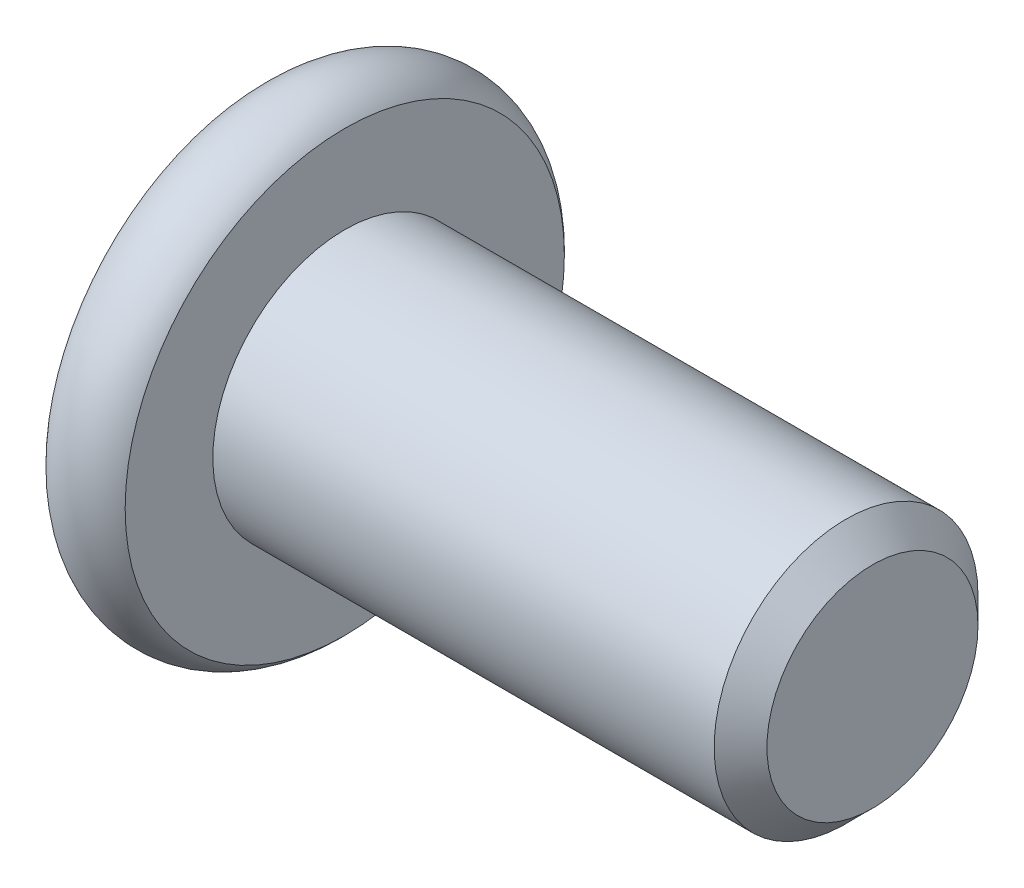
from build123d import *

# Parameters (mm, degrees)
SKETCH2_R           = 2.5
BOSS_EXTRUDE1_DEPTH = 10
CHAMFER1_SIZE       = 0.5
CUT_EXTRUDE1_DEPTH  = 2.3
SKETCH8_R           = 1.782050808
CUT_EXTRUDE2_DEPTH  = 1
CUT_EXTRUDE2_DRAFT  = -45


with BuildPart() as part:
    # Sketch2 → Boss-Extrude1 (new body)
    with BuildSketch(Plane(origin=(0, 0, 0), x_dir=(0, 0, -1), z_dir=(1, 0, 0))):
        Circle(SKETCH2_R)
    extrude(amount=-BOSS_EXTRUDE1_DEPTH)

    # Chamfer1
    chamfer1_edges = [part.edges().sort_by_distance(p)[0] for p in [
        (0, 0, 2.5),
    ]]
    chamfer(chamfer1_edges, length=CHAMFER1_SIZE)

    # Sketch6 → Revolve1 (revolve)
    with BuildSketch(Plane.XY):
        with BuildLine():
            Line((-11.5, 0), (-11.5, 4.161437828))
            ThreePointArc((-11.5, 4.161437828), (-10.75, 4.5), (-10, 4.161437828))
            Line((-10, 4.161437828), (-10, 0))
            Line((-10, 0), (-11.5, 0))
        make_face()
    revolve(axis=Axis((-10, 0, 0), (-1, 0, 0)))

    # Sketch7 → Cut-Extrude1 (cut)
    with BuildSketch(Plane.ZY.offset(11.5)):
        Polygon((0, 1.732050808), (-1.5, 0.866025404), (-1.5, -0.866025404), (0, -1.732050808), (1.5, -0.866025404), (1.5, 0.866025404), align=None)
    extrude(amount=-CUT_EXTRUDE1_DEPTH, mode=Mode.SUBTRACT)


with BuildPart() as cut_extrude2_tool:
    # Sketch8 → Cut-Extrude2 (with draft: the straight prism first)
    with BuildSketch(Plane.ZY.offset(11.5)):
        Circle(SKETCH8_R)
    extrude(amount=-CUT_EXTRUDE2_DEPTH)
    # Cut-Extrude2: the draft: its side faces are tilted about the plane it starts from
    cut_extrude2_sides = [cut_extrude2_tool.faces().sort_by_distance(p)[0] for p in [
        (-11, 0, -1.782050808),
    ]]
    draft(cut_extrude2_sides, Plane.ZY.offset(11.5), CUT_EXTRUDE2_DRAFT)


with BuildPart() as part_1:
    add(part.part)

    # Cut-Extrude2: cut by cut_extrude2_tool
    add(cut_extrude2_tool.part, mode=Mode.SUBTRACT)


solid = part_1.part
